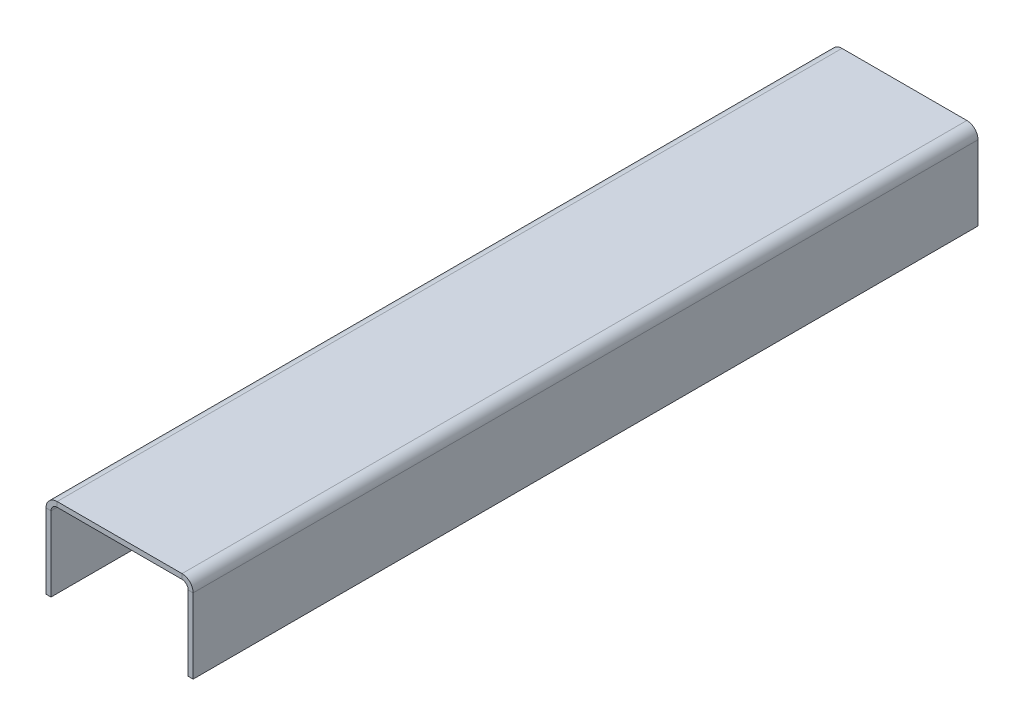
from build123d import *

# Parameters (mm, degrees)
BASE_FLANGE1_DEPTH = 406.4


# Sheet-metal steps are written as plain solids
with BuildPart() as part:
    # Sketch1 → Base-Flange1 (new body)
    with BuildSketch(Plane.XY):
        with BuildLine():
            Line((38.1, -44.45), (38.1, -5.76326))
            ThreePointArc((38.1, -5.76326), (36.411980228, -1.688019772), (32.33674, 0))
            Line((32.33674, 0), (-32.33674, 0))
            ThreePointArc((-32.33674, 0), (-36.411980228, -1.688019772), (-38.1, -5.76326))
            Line((-38.1, -5.76326), (-38.1, -44.45))
            Line((-38.1, -44.45), (-35.51174, -44.45))
            Line((-35.51174, -44.45), (-35.51174, -5.76326))
            ThreePointArc((-35.51174, -5.76326), (-34.58180403, -3.51819597), (-32.33674, -2.58826))
            Line((-32.33674, -2.58826), (32.33674, -2.58826))
            ThreePointArc((32.33674, -2.58826), (34.58180403, -3.51819597), (35.51174, -5.76326))
            Line((35.51174, -5.76326), (35.51174, -44.45))
            Line((35.51174, -44.45), (38.1, -44.45))
        make_face()
    extrude(amount=BASE_FLANGE1_DEPTH)


solid = part.part
